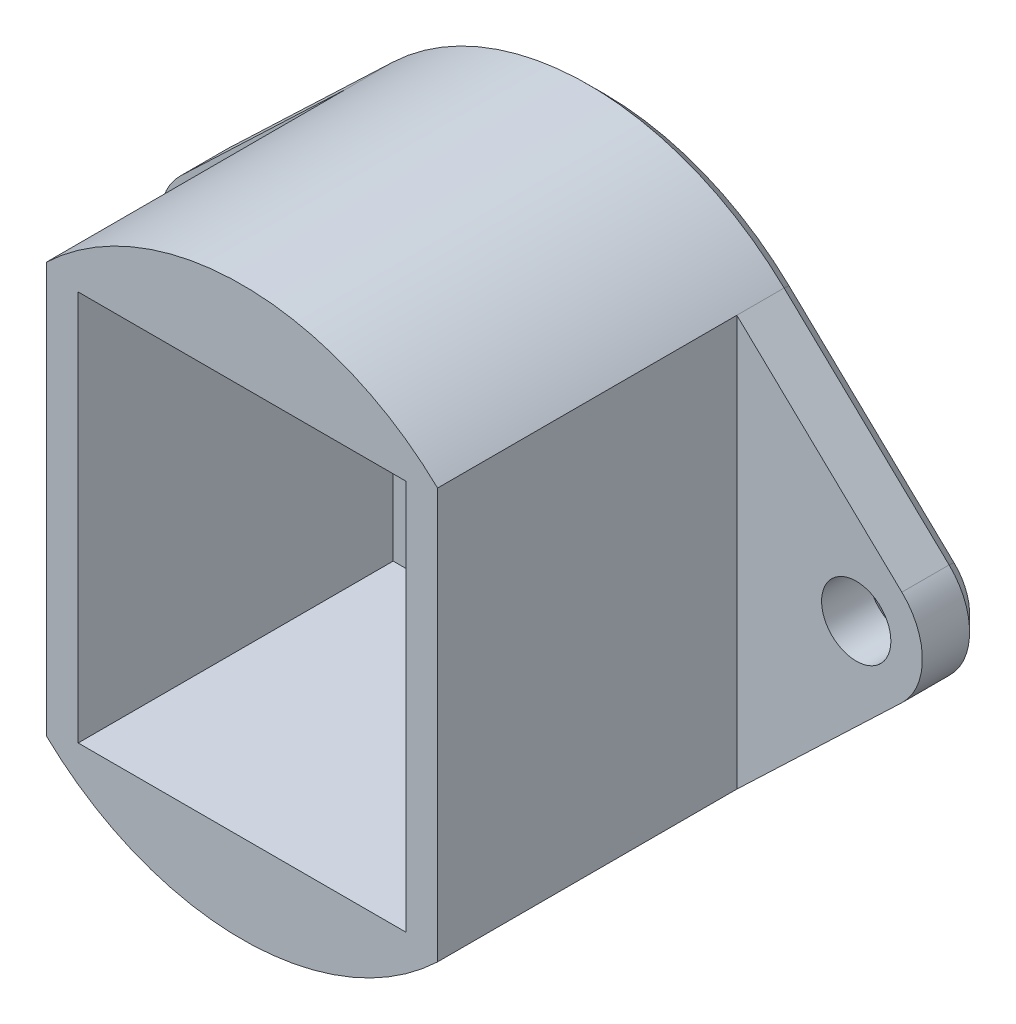
from build123d import *

# Parameters (mm, degrees)
SKETCH_2_R          = 1.1
SKETCH_2_R_2        = 1
SKETCH_2_R_3        = 1.7
EXTRUDE_1_DEPTH     = 2
SKETCH_3_W          = 10.4
SKETCH_3_H          = 12.4
EXTRUDE_2_DEPTH     = 9.5
SKETCH_4_W          = 10.4
SKETCH_4_H          = 12.4
CUT_EXTRUDE_1_DEPTH = 0.5
SKETCH_5_R          = 2.25
CUT_EXTRUDE_2_DEPTH = 0.9
CHAMFER_1_SIZE      = 0.5


with BuildPart() as part:
    # Эскиз2 → Бобышка-Вытянуть1 (new body)
    with BuildSketch(Plane.XY):
        with BuildLine():
            Line((6.21, 6.514284305), (11.449, 1.519999671))
            ThreePointArc((11.449, 1.519999671), (12.1, 0), (11.449, -1.519999671))
            Line((11.449, -1.519999671), (6.21, -6.514284305))
            ThreePointArc((6.21, -6.514284305), (0, -9), (-6.21, -6.514284305))
            Line((-6.21, -6.514284305), (-11.449, -1.519999671))
            ThreePointArc((-11.449, -1.519999671), (-12.1, 0), (-11.449, 1.519999671))
            Line((-11.449, 1.519999671), (-6.21, 6.514284305))
            ThreePointArc((-6.21, 6.514284305), (0, 9), (6.21, 6.514284305))
        make_face()
        with Locations((10, 0)):
            Circle(SKETCH_2_R, mode=Mode.SUBTRACT)
        with Locations((-10, 0)):
            Circle(SKETCH_2_R, mode=Mode.SUBTRACT)
        with Locations((0, 4.5)):
            Circle(SKETCH_2_R_2, mode=Mode.SUBTRACT)
        with Locations(Location((0, -4.5, 0), (0, 0, 180))):
            Circle(SKETCH_2_R_2, mode=Mode.SUBTRACT)
        Circle(SKETCH_2_R_3, mode=Mode.SUBTRACT)
    extrude(amount=EXTRUDE_1_DEPTH)

    # Эскиз3 → Бобышка-Вытянуть2 (add)
    with BuildSketch(Plane.XY.offset(2)):
        with BuildLine():
            Line((6.21, 6.514284305), (6.21, -6.514284305))
            ThreePointArc((6.21, -6.514284305), (0, -9), (-6.21, -6.514284305))
            Line((-6.21, -6.514284305), (-6.21, 6.514284305))
            ThreePointArc((-6.21, 6.514284305), (0, 9), (6.21, 6.514284305))
        make_face()
        Rectangle(SKETCH_3_W, SKETCH_3_H, mode=Mode.SUBTRACT)
    extrude(amount=EXTRUDE_2_DEPTH)

    # Эскиз4 → Вырез-Вытянуть1 (cut)
    with BuildSketch(Plane.XY.offset(2)):
        Rectangle(SKETCH_4_W, SKETCH_4_H)
    extrude(amount=-CUT_EXTRUDE_1_DEPTH, mode=Mode.SUBTRACT)

    # Эскиз5 → Вырез-Вытянуть2 (cut)
    with BuildSketch(Plane.XY.offset(1.5)):
        Circle(SKETCH_5_R)
    extrude(amount=-CUT_EXTRUDE_2_DEPTH, mode=Mode.SUBTRACT)

    # Фаска1
    chamfer_1_edges = [part.edges().sort_by_distance(p)[0] for p in [
        (-8.8295, 4.017141988, 0),
        (0, 9, 0),
        (8.9, 0, 0),
        (-1, 4.5, 0),
        (1, -4.5, 0),
        (-1.7, 0, 0),
        (-11.1, 0, 0),
        (8.8295, 4.017141988, 0),
        (12.1, 0, 0),
        (8.8295, -4.017141988, 0),
        (0, -9, 0),
        (-8.8295, -4.017141988, 0),
        (-12.1, 0, 0),
    ]]
    chamfer(chamfer_1_edges, length=CHAMFER_1_SIZE - 0.0001)  # a hair under: the kernel refuses the full size


solid = part.part
